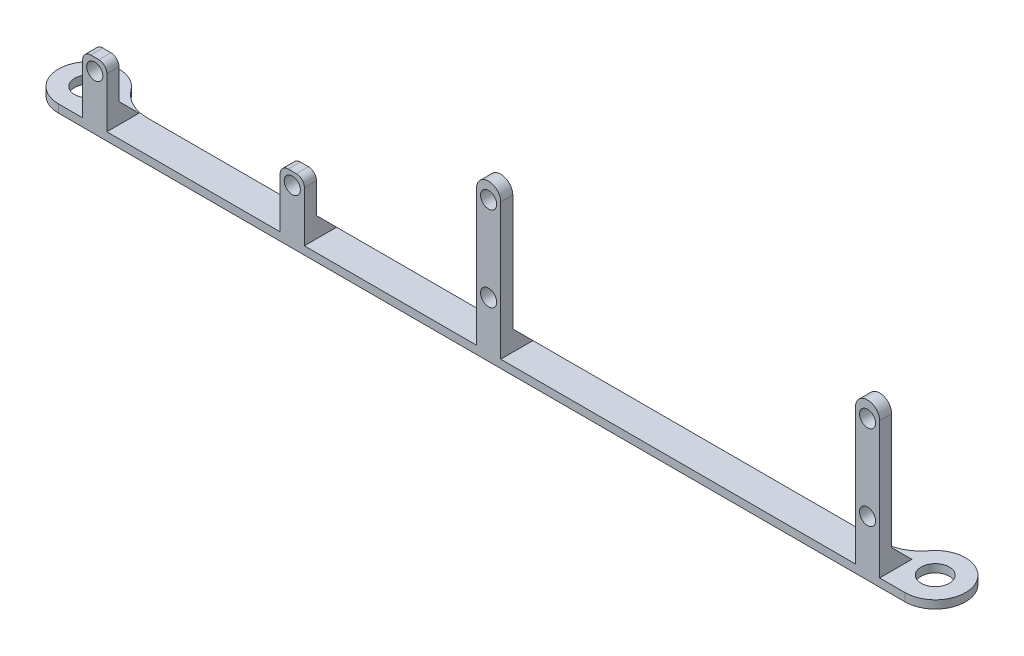
from build123d import *

# Parameters (mm, degrees)
SKETCH1_R           = 3.5
BOSS_EXTRUDE1_DEPTH = 2
SKETCH2_W           = 6
SKETCH2_H           = 36.75
SKETCH2_R           = 2
SKETCH2_H_2         = 14.5
BOSS_EXTRUDE2_DEPTH = 3
FILLET1_RADIUS      = 3
FILLET1_LENGTH      = 3
FILLET2_RADIUS      = 3
FILLET2_LENGTH      = 3
FILLET3_R           = 2
CHAMFER1_SIZE       = 5
CUT_EXTRUDE1_START  = -10
CUT_EXTRUDE1_DEPTH  = 10
FILLET4_R           = 10


with BuildPart() as part:
    # Sketch1 → Boss-Extrude1 (new body)
    with BuildSketch(Plane(origin=(0, -82.5, 0), x_dir=(1, 0, 0), z_dir=(0, 1, 0))):
        with BuildLine():
            Line((-105, 67.5), (105, 67.5))
            ThreePointArc((105, 67.5), (112.5, 60), (105, 52.5))
            Line((105, 52.5), (-105, 52.5))
            ThreePointArc((-105, 52.5), (-112.5, 60), (-105, 67.5))
        make_face()
        with Locations(Location((-105, 60, 0), (0, 0, 270))):
            Circle(SKETCH1_R, mode=Mode.SUBTRACT)
        with Locations(Location((105, 60, 0), (0, 0, 270))):
            Circle(SKETCH1_R, mode=Mode.SUBTRACT)
    extrude(amount=BOSS_EXTRUDE1_DEPTH)

    # Sketch2 → Boss-Extrude2 (add)
    # profile 1 of 4: a face of its own
    with BuildSketch(Plane(origin=(0, 0, -52.5), x_dir=(-1, 0, 0), z_dir=(0, 0, -1))):
        with Locations((-95.704993888, -62.125)):
            Rectangle(SKETCH2_W, SKETCH2_H)
        with Locations((-95.704993888, -47.75)):
            Circle(SKETCH2_R, mode=Mode.SUBTRACT)
        with Locations((-95.704993888, -68.75)):
            Circle(SKETCH2_R, mode=Mode.SUBTRACT)
    # profile 2 of 4: a face of its own
    with BuildSketch(Plane(origin=(0, 0, -52.5), x_dir=(-1, 0, 0), z_dir=(0, 0, -1))):
        with Locations((-1.704993888, -62.125)):
            Rectangle(SKETCH2_W, SKETCH2_H)
        with Locations((-1.704993888, -47.75)):
            Circle(SKETCH2_R, mode=Mode.SUBTRACT)
        with Locations((-1.704993888, -68.75)):
            Circle(SKETCH2_R, mode=Mode.SUBTRACT)
    # profile 3 of 4: a face of its own
    with BuildSketch(Plane(origin=(0, 0, -52.5), x_dir=(-1, 0, 0), z_dir=(0, 0, -1))):
        with Locations((47.003472144, -73.25)):
            Rectangle(SKETCH2_W, SKETCH2_H_2)
        with Locations((47.003472144, -69)):
            Circle(SKETCH2_R, mode=Mode.SUBTRACT)
    # profile 4 of 4: a face of its own
    with BuildSketch(Plane(origin=(0, 0, -52.5), x_dir=(-1, 0, 0), z_dir=(0, 0, -1))):
        with Locations((96.003472144, -73.25)):
            Rectangle(SKETCH2_W, SKETCH2_H_2)
        with Locations((96.003472144, -69)):
            Circle(SKETCH2_R, mode=Mode.SUBTRACT)
    extrude(amount=BOSS_EXTRUDE2_DEPTH)

    # Fillet1: full round fillet: the end face becomes a half cylinder, R = half its width
    fillet1_face = Plane((95.704993888, -43.75, -54), x_dir=(0, 0, -1), z_dir=(0, 1, 0))  # on the end face: x along it, z out of the body
    fillet1_slab = fillet1_face.offset(-FILLET1_RADIUS / 2) * Box(FILLET1_LENGTH, 2 * FILLET1_RADIUS, FILLET1_RADIUS, mode=Mode.PRIVATE)  # the body's end, R deep
    fillet1_round = Plane((95.704993888, -46.75, -54), x_dir=(0, 1, 0), z_dir=(0, 0, -1)) * Cylinder(FILLET1_RADIUS, FILLET1_LENGTH, mode=Mode.PRIVATE)  # its axis R under the face
    add(fillet1_slab - fillet1_round, mode=Mode.SUBTRACT)

    # Fillet2: full round fillet: the end face becomes a half cylinder, R = half its width
    fillet2_face = Plane((1.704993888, -43.75, -54), x_dir=(0, 0, -1), z_dir=(0, 1, 0))  # on the end face: x along it, z out of the body
    fillet2_slab = fillet2_face.offset(-FILLET2_RADIUS / 2) * Box(FILLET2_LENGTH, 2 * FILLET2_RADIUS, FILLET2_RADIUS, mode=Mode.PRIVATE)  # the body's end, R deep
    fillet2_round = Plane((1.704993888, -46.75, -54), x_dir=(0, 1, 0), z_dir=(0, 0, -1)) * Cylinder(FILLET2_RADIUS, FILLET2_LENGTH, mode=Mode.PRIVATE)  # its axis R under the face
    add(fillet2_slab - fillet2_round, mode=Mode.SUBTRACT)

    # Fillet3
    fillet3_edges = [part.edges().sort_by_distance(p)[0] for p in [
        (-44.003472144, -66, -54),
        (-50.003472144, -66, -54),
        (-99.003472144, -66, -54),
        (-93.003472144, -66, -54),
    ]]
    fillet(fillet3_edges, radius=FILLET3_R)

    # Chamfer1
    chamfer1_edges = [part.edges().sort_by_distance(p)[0] for p in [
        (95.704993888, -80.5, -55.5),
        (1.704993888, -80.5, -55.5),
        (-47.003472144, -80.5, -55.5),
        (-96.003472144, -80.5, -55.5),
    ]]
    chamfer(chamfer1_edges, length=CHAMFER1_SIZE)

    # Sketch3 → Cut-Extrude1 (cut)
    with BuildSketch(Plane(origin=(0, -80.5, 0), x_dir=(1, 0, 0), z_dir=(0, 1, 0)).offset(CUT_EXTRUDE1_START)):
        with BuildLine():
            Line((92.704993888, 60.5), (97.516685226, 60.5))
            ThreePointArc((97.516685226, 60.5), (99.876524617, 65.477225575), (105, 67.5))
            Line((105, 67.5), (-105, 67.5))
            ThreePointArc((-105, 67.5), (-99.876524617, 65.477225575), (-97.516685226, 60.5))
            Line((-97.516685226, 60.5), (-93.003472144, 60.5))
            Line((-93.003472144, 60.5), (-50.003472144, 60.5))
            Line((-50.003472144, 60.5), (-44.003472144, 60.5))
            Line((-44.003472144, 60.5), (-1.295006112, 60.5))
            Line((-1.295006112, 60.5), (4.704993888, 60.5))
            Line((4.704993888, 60.5), (92.704993888, 60.5))
        make_face()
    extrude(amount=CUT_EXTRUDE1_DEPTH, mode=Mode.SUBTRACT)

    # Fillet4
    # the kernel refuses this fillet: 10 mm, written as the material it adds along each edge
    with BuildSketch(Plane(origin=(97.516685226, -82.5, -60.5), x_dir=(-1, 0, 0), z_dir=(0, 1, 0))) as fillet4_piece_1_section:
        with BuildLine():
            CenterArc((6.516685226, -10), FILLET4_R, 90, 53.130102354)
            ThreePointArc((-1.483314774, -4), (-0.451249336, -2.107691638), (0, 0))
            Line((0, 0), (6.516685226, 0))
        make_face()
    fillet4_piece_1 = extrude(amount=2, mode=Mode.PRIVATE)
    fillet4_piece_1 = split(fillet4_piece_1, bisect_by=Plane(origin=(95.39414114, -81.261061564, -61.261061564), z_dir=(0, -0.7071067811865476, 0.7071067811865476)), keep=Keep.TOP, mode=Mode.PRIVATE)
    add(fillet4_piece_1)
    with BuildSketch(Plane(origin=(97.516685226, -82.5, -60.5), x_dir=(-1, 0, 0), z_dir=(0, 1, 0))) as fillet4_piece_2_section:
        with BuildLine():
            CenterArc((6.516685226, -10), FILLET4_R, 90, 53.130102354)
            ThreePointArc((-1.483314774, -4), (-0.451249336, -2.107691638), (0, 0))
            Line((0, 0), (6.516685226, 0))
        make_face()
    fillet4_piece_2 = extrude(amount=2, mode=Mode.PRIVATE)
    fillet4_piece_2 = split(fillet4_piece_2, bisect_by=Plane(origin=(97.181808866, -81.694028368, -61.694028368), z_dir=(0, 0.7071067811865476, -0.7071067811865476)), keep=Keep.TOP, mode=Mode.PRIVATE)
    add(fillet4_piece_2)
    with BuildSketch(Plane(origin=(-97.516685226, -82.5, -60.5), x_dir=(1, 0, 0), z_dir=(0, 1, 0))) as fillet4_piece_3_section:
        with BuildLine():
            CenterArc((6.516685226, 10), FILLET4_R, 216.869897646, 53.130102354)
            ThreePointArc((-1.483314774, 4), (-0.451249336, 2.107691638), (0, 0))
            Line((0, 0), (6.516685226, 0))
        make_face()
    fillet4_piece_3 = extrude(amount=2, mode=Mode.PRIVATE)
    fillet4_piece_3 = split(fillet4_piece_3, bisect_by=Plane(origin=(-95.39414114, -81.261061564, -61.261061564), z_dir=(0, -0.7071067811865476, 0.7071067811865476)), keep=Keep.TOP, mode=Mode.PRIVATE)
    add(fillet4_piece_3)
    with BuildSketch(Plane(origin=(-97.516685226, -82.5, -60.5), x_dir=(1, 0, 0), z_dir=(0, 1, 0))) as fillet4_piece_4_section:
        with BuildLine():
            CenterArc((6.516685226, 10), FILLET4_R, 216.869897646, 53.130102354)
            ThreePointArc((-1.483314774, 4), (-0.451249336, 2.107691638), (0, 0))
            Line((0, 0), (6.516685226, 0))
        make_face()
    fillet4_piece_4 = extrude(amount=2, mode=Mode.PRIVATE)
    fillet4_piece_4 = split(fillet4_piece_4, bisect_by=Plane(origin=(-97.181808866, -81.694028368, -61.694028368), z_dir=(0, 0.7071067811865476, -0.7071067811865476)), keep=Keep.TOP, mode=Mode.PRIVATE)
    add(fillet4_piece_4)


solid = part.part
